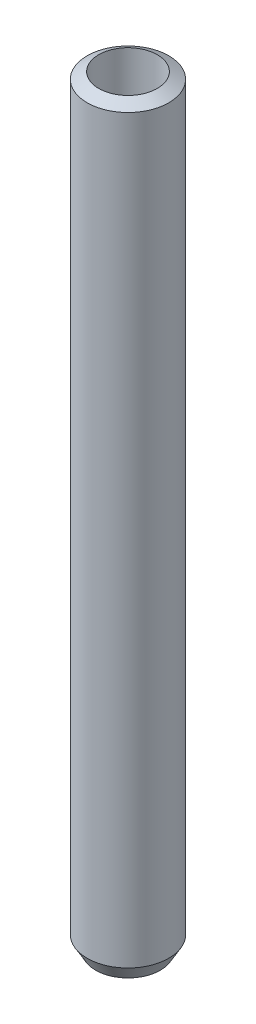
from build123d import *

# Parameters (mm, degrees)
SKETCH1_R           = 12.5
BOSS_EXTRUDE1_DEPTH = 234.095436
SKETCH2_R           = 8.972662212
CUT_EXTRUDE1_DEPTH  = 235.761949975
CHAMFER1_SIZE       = 2.583631
CHAMFER1_SIZE_2     = 4.47498


with BuildPart() as part:
    # Sketch1 → Boss-Extrude1 (new body)
    with BuildSketch(Plane(origin=(0, 0, 0), x_dir=(1, 0, 0), z_dir=(0, 1, 0))):
        with Locations(Location((0, 0, 0), (0, 0, 270))):
            Circle(SKETCH1_R)
    extrude(amount=BOSS_EXTRUDE1_DEPTH)

    # Sketch2 → Cut-Extrude1 (cut, through all)
    with BuildSketch(Plane(origin=(0, 0, 0), x_dir=(1, 0, 0), z_dir=(0, 1, 0))):
        with Locations(Location((0, 0, 0), (0, 0, 270))):
            Circle(SKETCH2_R)
    extrude(amount=CUT_EXTRUDE1_DEPTH, mode=Mode.SUBTRACT)

    # Chamfer1
    # the kernel refuses this chamfer: 4.47498, 2.583631 mm, written as the material it takes off along each edge
    with BuildSketch(Plane(origin=(0, 234.095436, 0), x_dir=(0, 0, 1), z_dir=(-1, 0, 0))) as chamfer1_piece_1:
        Polygon((12.5, -CHAMFER1_SIZE), (12.5 - CHAMFER1_SIZE_2, 0), (12.5, 0), align=None)
    revolve(axis=Axis((0, 234.095436, 0), (0, 1, 0)), mode=Mode.SUBTRACT)
    with BuildSketch(Plane(origin=(0, 0, 0), x_dir=(0, 0, 1), z_dir=(-1, 0, 0))) as chamfer1_piece_2:
        Polygon((12.5, CHAMFER1_SIZE_2), (12.5 - CHAMFER1_SIZE, 0), (12.5, 0), align=None)
    revolve(axis=Axis((0, 0, 0), (0, 1, 0)), mode=Mode.SUBTRACT)


solid = part.part
